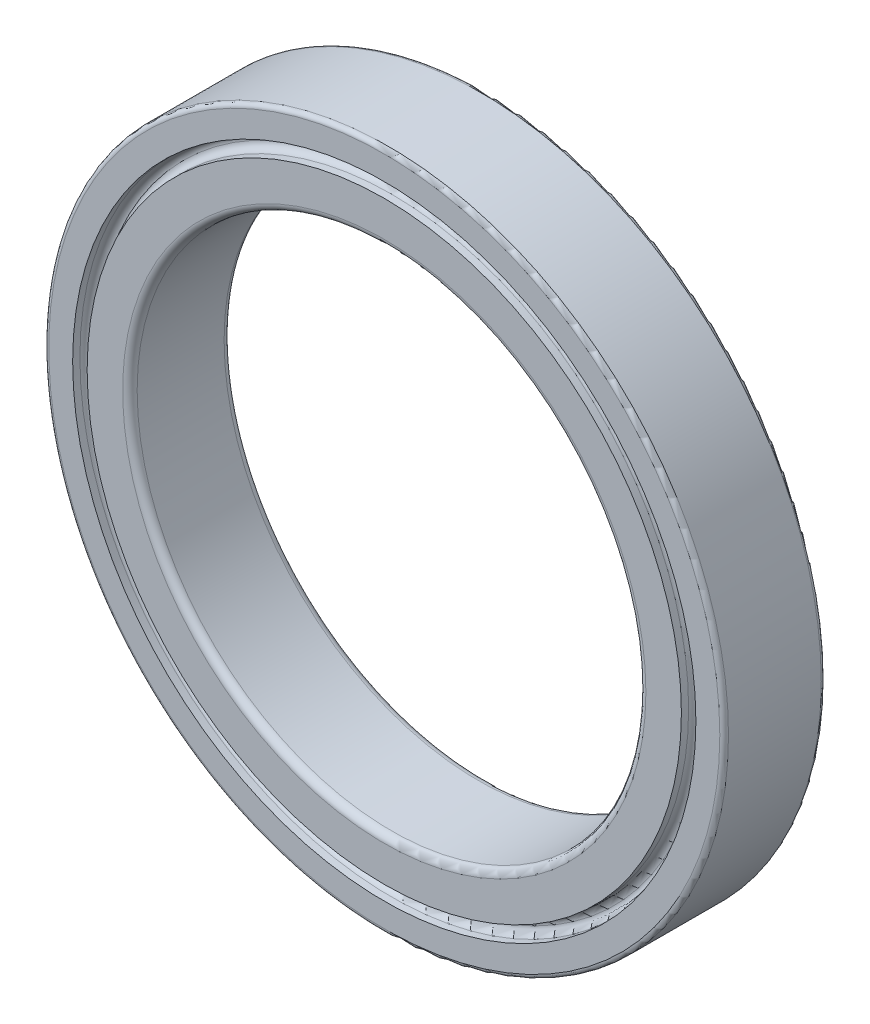
from build123d import *

# Parameters (mm, degrees)
SKETCH1_R           = 23.45
BOSS_EXTRUDE1_DEPTH = 7
SKETCH2_R           = 17.55
CUT_EXTRUDE1_DEPTH  = 34.894026022
FILLET1_R           = 0.5
SKETCH3_R           = 21.5
SKETCH3_R_2         = 20.5
CUT_EXTRUDE2_DEPTH  = 1
FILLET2_R           = 0.5
FILLET4_R           = 0.3
SKETCH4_R           = 22
SKETCH4_R_2         = 21
CUT_EXTRUDE3_DEPTH  = 1
FILLET5_R           = 0.5


with BuildPart() as part:
    # Sketch1 → Boss-Extrude1 (new body)
    with BuildSketch(Plane.XY):
        Circle(SKETCH1_R)
    extrude(amount=BOSS_EXTRUDE1_DEPTH)

    # Sketch2 → Cut-Extrude1 (cut, through all)
    with BuildSketch(Plane.XY.offset(7)):
        Circle(SKETCH2_R)
    extrude(amount=-CUT_EXTRUDE1_DEPTH, mode=Mode.SUBTRACT)

    # Fillet1
    fillet1_edges = [part.edges().sort_by_distance(p)[0] for p in [
        (-17.55, 0, 0),
        (-17.55, 0, 7),
    ]]
    fillet(fillet1_edges, radius=FILLET1_R)

    # Sketch3 → Cut-Extrude2 (cut)
    with BuildSketch(Plane.XY.offset(7)):
        Circle(SKETCH3_R)
        Circle(SKETCH3_R_2, mode=Mode.SUBTRACT)
    extrude(amount=-CUT_EXTRUDE2_DEPTH, mode=Mode.SUBTRACT)

    # Fillet2
    fillet2_edges = [part.edges().sort_by_distance(p)[0] for p in [
        (-21.5, 0, 6),
        (-20.5, 0, 6),
    ]]
    fillet(fillet2_edges, radius=FILLET2_R - 0.0001)  # a hair under: the kernel refuses the full size

    # Fillet4
    fillet4_edges = [part.edges().sort_by_distance(p)[0] for p in [
        (-23.45, 0, 0),
        (-23.45, 0, 7),
    ]]
    fillet(fillet4_edges, radius=FILLET4_R)

    # Sketch4 → Cut-Extrude3 (cut)
    with BuildSketch(Plane(origin=(0, 0, 0), x_dir=(-1, 0, 0), z_dir=(0, 0, -1))):
        Circle(SKETCH4_R)
        Circle(SKETCH4_R_2, mode=Mode.SUBTRACT)
    extrude(amount=-CUT_EXTRUDE3_DEPTH, mode=Mode.SUBTRACT)

    # Fillet5
    fillet5_edges = [part.edges().sort_by_distance(p)[0] for p in [
        (22, 0, 1),
        (21, 0, 1),
    ]]
    fillet(fillet5_edges, radius=FILLET5_R - 0.0001)  # a hair under: the kernel refuses the full size


solid = part.part
